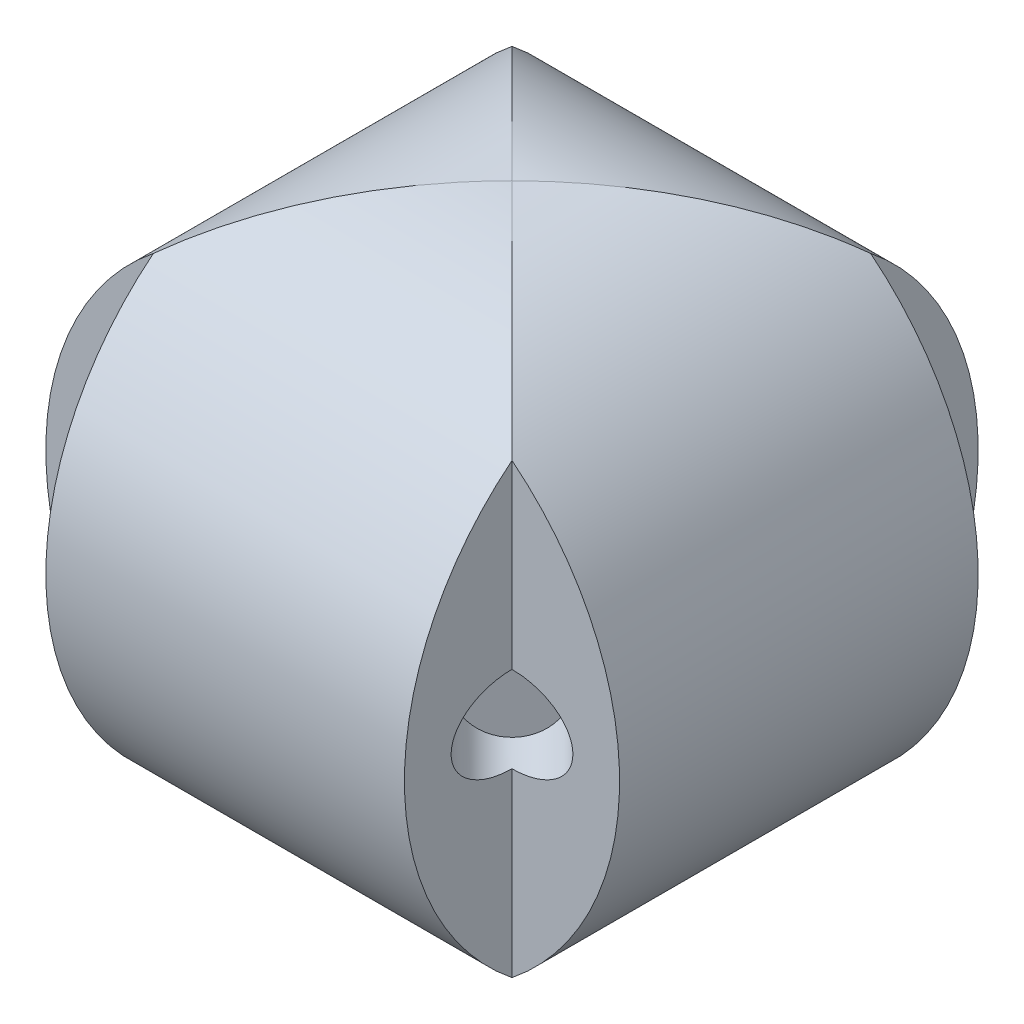
from build123d import *
from OCP.BRepAlgoAPI import BRepAlgoAPI_Cut
from OCP.TopTools import TopTools_ListOfShape

# Parameters (mm, degrees)
CUT_EXTRUDE_2_DEPTH      = 59.108987417
CUT_EXTRUDE_2_DEPTH_BACK = 59.108987417
SKETCH_6_W               = 109.700764472
SKETCH_6_H               = 102.082655829
SKETCH_6_W_2             = 40
SKETCH_6_H_2             = 40
SKETCH_7_W               = 10.430230832
SKETCH_7_H               = 9.900213331
CUT_EXTRUDE_3_DEPTH      = 66.9796091
SKETCH_8_W               = 20.261670598
SKETCH_8_H               = 3
SKETCH_9_W               = 20.800473715
SKETCH_9_H               = 3
SKETCH_11_W              = 20.381404624
SKETCH_11_H              = 3
SKETCH_12_W              = 21.399143843
SKETCH_12_H              = 3


with BuildPart() as part:
    # 草图3 → 旋转1 (revolve)
    with BuildSketch(Plane(origin=(0, 0, 0), x_dir=(0, 0, -1), z_dir=(1, 0, 0))):
        with BuildLine():
            Line((0, 40), (0, -40))
            ThreePointArc((0, -40), (40, 0), (0, 40))
        make_face()
    revolve(axis=Axis((0, 40, 0), (0, -1, 0)))

    # 草图4 → 切除-旋转3 (revolve, cut)
    with BuildSketch(Plane.XY):
        Polygon((-25, 50), (25, 50), (12.5, 20), (-12.5, 20), align=None)
    revolve(axis=Axis((-55.247864245, 0, 0), (1, 0, 0)), mode=Mode.SUBTRACT)


with BuildPart() as cut_revolve_4_tool:
    # 草图5 → 切除-旋转4 (revolve)
    with BuildSketch(Plane(origin=(0, 0, 0), x_dir=(1, 0, 0), z_dir=(0, 1, 0))):
        Polygon((-50, 25), (-50, -25), (-20, -12.5), (-20, 12.5), align=None)
    revolve(axis=Axis((0, 0, -44.002313129), (0, 0, 1)))


with BuildPart() as part_1:
    add(part.part)

    # 切除-旋转4: cut by cut_revolve_4_tool, with a tolerance
    cut_revolve_4_stock = TopTools_ListOfShape()
    cut_revolve_4_stock.Append(part_1.part.wrapped)
    cut_revolve_4_tools = TopTools_ListOfShape()
    cut_revolve_4_tools.Append(cut_revolve_4_tool.part.wrapped)
    cut_revolve_4_cut = BRepAlgoAPI_Cut()
    cut_revolve_4_cut.SetArguments(cut_revolve_4_stock)
    cut_revolve_4_cut.SetTools(cut_revolve_4_tools)
    cut_revolve_4_cut.SetFuzzyValue(0.00001)
    cut_revolve_4_cut.Build()
    add(Compound.cast(cut_revolve_4_cut.Shape()).solids(), mode=Mode.REPLACE)

    # 草图6 → 切除-拉伸2 (cut, two sides: drawn at the far end of the back side and taken through both)
    with BuildSketch(Plane(origin=(0, 0, 0), x_dir=(1, 0, 0), z_dir=(0, 1, 0)).offset(-CUT_EXTRUDE_2_DEPTH_BACK)):
        with Locations((-5.024851986, -5.217653308)):
            Rectangle(SKETCH_6_W, SKETCH_6_H)
        Rectangle(SKETCH_6_W_2, SKETCH_6_H_2, mode=Mode.SUBTRACT)
    extrude(amount=CUT_EXTRUDE_2_DEPTH + CUT_EXTRUDE_2_DEPTH_BACK, mode=Mode.SUBTRACT)

    # 草图7 → 切除-拉伸3 (cut, through all)
    with BuildSketch(Plane(origin=(0, 29.80481839, 0), x_dir=(1, 0, 0), z_dir=(0, 1, 0))):
        Polygon((-12.5, 20), (-12.5, 12.5), (-20, 12.5), (-20, 22.400213331), (-12.5, 22.400213331), align=None)
        with Locations((17.715115416, 17.450106666)):
            Rectangle(SKETCH_7_W, SKETCH_7_H)
        Polygon((-12.5, -12.5), (-12.5, -22.2886307), (-23.264978728, -21.674926225), (-21.87019583, -13.864142), (-20, -12.5), align=None)
        Polygon((12.5, -12.5), (12.5, -20), (16.291064241, -21.981778462), (20, -20), (23.264978728, -15.681813192), (21.632489364, -12.626578567), (20, -12.5), align=None)
    extrude(amount=-CUT_EXTRUDE_3_DEPTH, mode=Mode.SUBTRACT)

    # 草图8 → 切除-旋转5 (revolve, cut)
    with BuildSketch(Plane(origin=(0, 0, 0), x_dir=(-0.7071067811865477, 0, -0.7071067811865475), z_dir=(0.7071067811865475, 0, -0.7071067811865477))):
        with Locations((25.130835299, 1.5)):
            Rectangle(SKETCH_8_W, SKETCH_8_H)
    revolve(axis=Axis((17.737263362, 0, 17.737263362), (-0.7071067811865476, 0, -0.7071067811865475)), mode=Mode.SUBTRACT)

    # 草图9 → 切除-旋转6 (revolve, cut)
    with BuildSketch(Plane(origin=(0, 0, 0), x_dir=(-0.7071067811865477, 0, 0.7071067811865475), z_dir=(-0.7071067811865475, 0, -0.7071067811865477))):
        with Locations((-25.400236858, 1.5)):
            Rectangle(SKETCH_9_W, SKETCH_9_H)
    revolve(axis=Axis((17.65259862, 0, -17.65259862), (-0.7071067811865477, 0, 0.7071067811865475)), mode=Mode.SUBTRACT)

    # 草图11 → 切除-旋转10 (revolve, cut)
    with BuildSketch(Plane(origin=(0, 0, 0), x_dir=(0.7071067811865476, 0, -0.7071067811865475), z_dir=(0.7071067811865475, 0, 0.7071067811865476))):
        with Locations((-25.190702312, 1.5)):
            Rectangle(SKETCH_11_W, SKETCH_11_H)
    revolve(axis=Axis((-18.922569744, 0, 18.922569744), (0.7071067811865476, 0, -0.7071067811865475)), mode=Mode.SUBTRACT)

    # 草图12 → 切除-旋转11 (revolve, cut)
    with BuildSketch(Plane(origin=(0, 0, 0), x_dir=(0.7071067811865477, 0, 0.7071067811865475), z_dir=(-0.7071067811865475, 0, 0.7071067811865477))):
        with Locations((25.699571922, 1.5)):
            Rectangle(SKETCH_12_W, SKETCH_12_H)
    revolve(axis=Axis((0, 0, 0), (0.7071067811865477, 0, 0.7071067811865475)), mode=Mode.SUBTRACT)


solid = part_1.part
